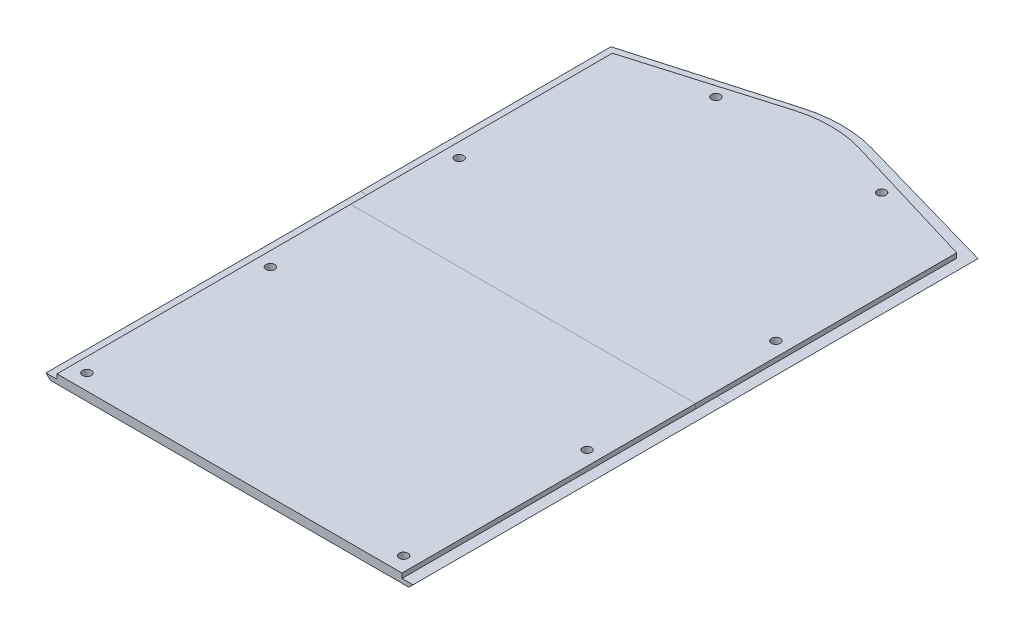
from build123d import *

# Parameters (mm, degrees)
BOSS_EXTRUDE1_DEPTH    = 2.25
BOSS_EXTRUDE2_DEPTH    = 2
CHAMFER1_SIZE          = 2
CUT_EXTRUDE1_REACH     = 177.436
SKETCH5_R              = 2.1
SPLIT1_SURFACE_1_BACK  = 341.45
SPLIT1_SURFACE_1_DEPTH = 682.9
SPLIT1_SURFACE_2_BACK  = 341.45
SPLIT1_SURFACE_2_DEPTH = 682.9
SKETCH7_R              = 2.5
BOSS_EXTRUDE3_DEPTH    = 2
CHAMFER2_SIZE          = 0.25
SKETCH9_R              = 2.5
CUT_EXTRUDE2_DEPTH     = 2


with BuildPart() as part:
    # Sketch3 → Boss-Extrude1 (new body)
    with BuildSketch(Plane.XZ):
        with BuildLine():
            Line((82.25, 140), (82.25, -124.502754064))
            Line((82.25, -124.502754064), (15.180121042, -144.629148882))
            ThreePointArc((15.180121042, -144.629148882), (7.687460253, -146.219552794), (0.046174732, -146.748803111))
            ThreePointArc((0.046174732, -146.748803111), (-7.595110788, -146.219552794), (-15.087771577, -144.629148882))
            Line((-15.087771577, -144.629148882), (-82.25, -124.813107271))
            Line((-82.25, -124.813107271), (-82.25, 140))
            Line((-82.25, 140), (82.25, 140))
        make_face()
    extrude(amount=-BOSS_EXTRUDE1_DEPTH)

    # Sketch4 → Boss-Extrude2 (add)
    with BuildSketch(Plane.XZ):
        with BuildLine():
            Line((87.5, 140), (-87.5, 140))
            Line((-87.5, 140), (-87.5, -129.399764523))
            Line((-87.5, -129.399764523), (-16.483267674, -149.690259473))
            ThreePointArc((-16.483267674, -149.690259473), (0, -151.998822615), (16.483267674, -149.690259473))
            Line((16.483267674, -149.690259473), (87.5, -129.399764523))
            Line((87.5, -129.399764523), (87.5, 140))
        make_face()
    extrude(amount=BOSS_EXTRUDE2_DEPTH)

    # Chamfer1
    chamfer1_edges = [part.edges().sort_by_distance(p)[0] for p in [
        (87.5, -2, 5.300117739),
        (51.991633837, -2, -139.545011998),
        (0, -2, -151.998822615),
        (-51.991633837, -2, -139.545011998),
        (-87.5, -2, 5.300117739),
    ]]
    chamfer(chamfer1_edges, length=CHAMFER1_SIZE - 0.0001)  # a hair under: the kernel refuses the full size

    # Sketch5 → Cut-Extrude1 (cut, up to next)
    with BuildSketch(Plane.XZ.offset(2), mode=Mode.PRIVATE) as cut_extrude1_sk1:
        with Locations(Location((39.5, -131.431881025, 0), (0, 0, 270))):
            Circle(SKETCH5_R)
    cut_extrude1_tool1 = extrude(cut_extrude1_sk1.sketch, amount=-CUT_EXTRUDE1_REACH, mode=Mode.PRIVATE) & part.part
    # Sketch5 → Cut-Extrude1 (cut, up to next)
    with BuildSketch(Plane.XZ.offset(2), mode=Mode.PRIVATE) as cut_extrude1_sk2:
        with Locations(Location((75.5, -45.018802154, 0), (0, 0, 270))):
            Circle(SKETCH5_R)
    cut_extrude1_tool2 = extrude(cut_extrude1_sk2.sketch, amount=-CUT_EXTRUDE1_REACH, mode=Mode.PRIVATE) & part.part
    # Sketch5 → Cut-Extrude1 (cut, up to next)
    with BuildSketch(Plane.XZ.offset(2), mode=Mode.PRIVATE) as cut_extrude1_sk3:
        with Locations(Location((75.5, 45.018802154, 0), (0, 0, 270))):
            Circle(SKETCH5_R)
    cut_extrude1_tool3 = extrude(cut_extrude1_sk3.sketch, amount=-CUT_EXTRUDE1_REACH, mode=Mode.PRIVATE) & part.part
    # Sketch5 → Cut-Extrude1 (cut, up to next)
    with BuildSketch(Plane.XZ.offset(2), mode=Mode.PRIVATE) as cut_extrude1_sk4:
        with Locations(Location((75.5, 132.481197846, 0), (0, 0, 270))):
            Circle(SKETCH5_R)
    cut_extrude1_tool4 = extrude(cut_extrude1_sk4.sketch, amount=-CUT_EXTRUDE1_REACH, mode=Mode.PRIVATE) & part.part
    # Sketch5 → Cut-Extrude1 (cut, up to next)
    with BuildSketch(Plane.XZ.offset(2), mode=Mode.PRIVATE) as cut_extrude1_sk5:
        with Locations(Location((-75.5, 132.481197846, 0), (0, 0, 270))):
            Circle(SKETCH5_R)
    cut_extrude1_tool5 = extrude(cut_extrude1_sk5.sketch, amount=-CUT_EXTRUDE1_REACH, mode=Mode.PRIVATE) & part.part
    # Sketch5 → Cut-Extrude1 (cut, up to next)
    with BuildSketch(Plane.XZ.offset(2), mode=Mode.PRIVATE) as cut_extrude1_sk6:
        with Locations(Location((-75.5, 45.018802154, 0), (0, 0, 270))):
            Circle(SKETCH5_R)
    cut_extrude1_tool6 = extrude(cut_extrude1_sk6.sketch, amount=-CUT_EXTRUDE1_REACH, mode=Mode.PRIVATE) & part.part
    # Sketch5 → Cut-Extrude1 (cut, up to next)
    with BuildSketch(Plane.XZ.offset(2), mode=Mode.PRIVATE) as cut_extrude1_sk7:
        with Locations(Location((-75.5, -45.018802154, 0), (0, 0, 270))):
            Circle(SKETCH5_R)
    cut_extrude1_tool7 = extrude(cut_extrude1_sk7.sketch, amount=-CUT_EXTRUDE1_REACH, mode=Mode.PRIVATE) & part.part
    # Sketch5 → Cut-Extrude1 (cut, up to next)
    with BuildSketch(Plane.XZ.offset(2), mode=Mode.PRIVATE) as cut_extrude1_sk8:
        with Locations(Location((-39.5, -131.431881025, 0), (0, 0, 270))):
            Circle(SKETCH5_R)
    cut_extrude1_tool8 = extrude(cut_extrude1_sk8.sketch, amount=-CUT_EXTRUDE1_REACH, mode=Mode.PRIVATE) & part.part
    add(cut_extrude1_tool1.solids().sort_by_distance((39.5, -2, -131.431881))[0], mode=Mode.SUBTRACT)
    add(cut_extrude1_tool2.solids().sort_by_distance((75.5, -2, -45.018802))[0], mode=Mode.SUBTRACT)
    add(cut_extrude1_tool3.solids().sort_by_distance((75.5, -2, 45.018802))[0], mode=Mode.SUBTRACT)
    add(cut_extrude1_tool4.solids().sort_by_distance((75.5, -2, 132.481198))[0], mode=Mode.SUBTRACT)
    add(cut_extrude1_tool5.solids().sort_by_distance((-75.5, -2, 132.481198))[0], mode=Mode.SUBTRACT)
    add(cut_extrude1_tool6.solids().sort_by_distance((-75.5, -2, 45.018802))[0], mode=Mode.SUBTRACT)
    add(cut_extrude1_tool7.solids().sort_by_distance((-75.5, -2, -45.018802))[0], mode=Mode.SUBTRACT)
    add(cut_extrude1_tool8.solids().sort_by_distance((-39.5, -2, -131.431881))[0], mode=Mode.SUBTRACT)


with BuildPart() as body_2:
    # Split1: the piece behind the surface
    add(part.part)
    # Split1 surface: a surface, the sketch's curves swept straight by 682.9 mm
    with BuildLine(Plane(origin=(0, 0, 0), x_dir=(0, 0, -1), z_dir=(1, 0, 0)).offset(-SPLIT1_SURFACE_1_BACK), mode=Mode.PRIVATE) as split1_surface_1_path:
        Line((10, -2), (10, 0))
        Line((10, 0), (0, 0))
        Line((0, 0), (0, 2.25))
    split1_surface_1 = Shell.extrude(split1_surface_1_path.wire(), (1 * SPLIT1_SURFACE_1_DEPTH, 0 * SPLIT1_SURFACE_1_DEPTH, 0 * SPLIT1_SURFACE_1_DEPTH))
    split(bisect_by=split1_surface_1, keep=Keep.BOTTOM)

    # Sketch7 → Boss-Extrude3 (add)
    with BuildSketch(Plane.XZ):
        with Locations(Location((72.25, -5, 0), (0, 0, 90))):
            Circle(SKETCH7_R)
        with Locations(Location((-72.25, -5, 0), (0, 0, 90))):
            Circle(SKETCH7_R)
    extrude(amount=BOSS_EXTRUDE3_DEPTH)

    # Chamfer2
    chamfer2_edges = [body_2.edges().sort_by_distance(p)[0] for p in [
        (72.25, -2, -7.5),
    ]]
    chamfer(chamfer2_edges, length=CHAMFER2_SIZE)


with BuildPart() as part_1:
    add(part.part)

    # Split1: split by a surface, the side it looks to stays
    # Split1 surface: a surface, the sketch's curves swept straight by 682.9 mm
    with BuildLine(Plane(origin=(0, 0, 0), x_dir=(0, 0, -1), z_dir=(1, 0, 0)).offset(-SPLIT1_SURFACE_2_BACK), mode=Mode.PRIVATE) as split1_surface_2_path:
        Line((10, -2), (10, 0))
        Line((10, 0), (0, 0))
        Line((0, 0), (0, 2.25))
    split1_surface_2 = Shell.extrude(split1_surface_2_path.wire(), (1 * SPLIT1_SURFACE_2_DEPTH, 0 * SPLIT1_SURFACE_2_DEPTH, 0 * SPLIT1_SURFACE_2_DEPTH))
    split(bisect_by=split1_surface_2, keep=Keep.TOP)

    # Sketch9 → Cut-Extrude2 (cut)
    with BuildSketch(Plane(origin=(0, 0, 0), x_dir=(1, 0, 0), z_dir=(0, 1, 0))):
        with Locations(Location((72.25, 5, 0), (0, 0, 270))):
            Circle(SKETCH9_R)
        with Locations(Location((-72.25, 5, 0), (0, 0, 90))):
            Circle(SKETCH9_R)
    extrude(amount=-CUT_EXTRUDE2_DEPTH, mode=Mode.SUBTRACT)


solid = Compound([body_2.part, part_1.part])
